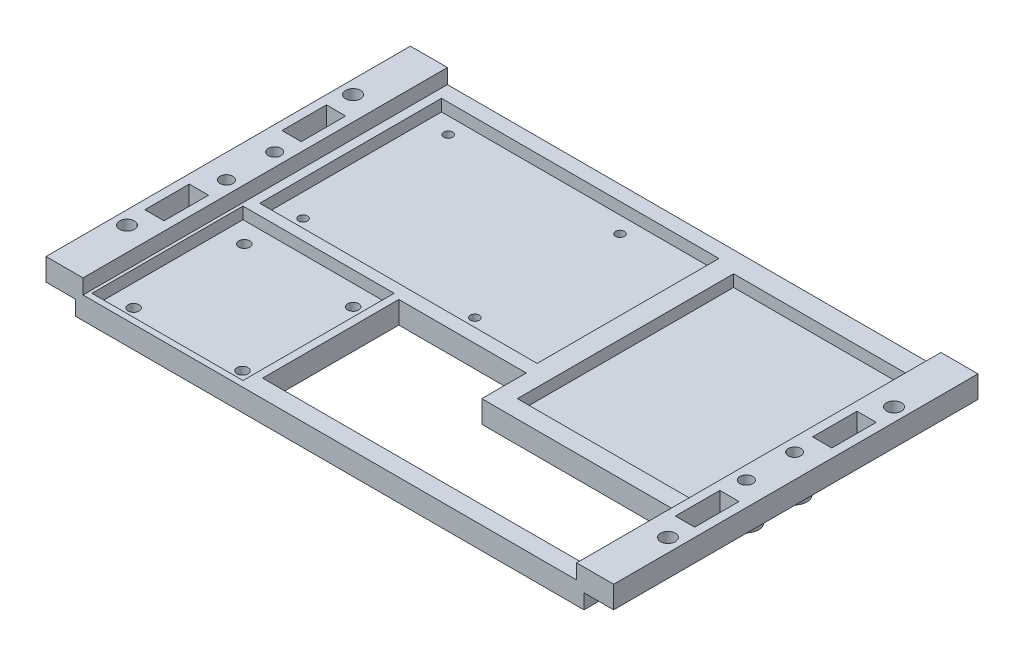
from build123d import *

# Parameters (mm, degrees)
PLATEFRAME_DEPTH          = 150
SKETCH3_R                 = 2.5
HOLESUPPORT_DEPTH         = 244.653052515
SKETCH4_R                 = 4.15
SKETCH4_R_2               = 2.15
CYLINDRICALSUPPORTS_DEPTH = 12.5
SKETCH5_W                 = 43
SKETCH5_H                 = 43
SKETCH5_W_2               = 89.65
SKETCH5_H_2               = 57.35
SKETCH5_W_3               = 58
SKETCH5_H_3               = 73
ITEMLAYOUT_DEPTH          = 4
HOLECUTOUT_DEPTH          = 7.5
SKETCH7_R                 = 1.5
HOLERASPBERRYPI_DEPTH     = 3.5
SKETCH8_R                 = 1.85
HOLEMOTORDRIVER_DEPTH     = 3.5
SKETCH10_W                = 45
SKETCH10_H                = 45
SKETCH10_W_2              = 43
SKETCH10_H_2              = 43
CUTMOTORDRIVER_DEPTH      = 4
SKETCH11_W                = 93.65
SKETCH11_H                = 61.35
SKETCH11_W_2              = 89.65
SKETCH11_H_2              = 57.35
CUTPASPBERRYPI_DEPTH      = 4
SKETCH12_W                = 191.6
SKETCH12_H                = 13
SKETCH12_H_2              = 14
CUTPLATEEDGES_DEPTH       = 12.5
SKETCH13_W                = 6.5
SKETCH13_H                = 15
CUTSHELLHOLES_DEPTH       = 12.5
SKETCH14_W                = 51
SKETCH14_H                = 51
CUTMOTORDRIVER2_DEPTH     = 4
SKETCH15_R                = 2.5
STANDOFFHOLES_DEPTH       = 236.293030071
SKETCH16_W                = 2.5
SKETCH16_H                = 28
CUT_EXTRUDE1_DEPTH        = 5


with BuildPart() as part:
    # Sketch2 → PlateFrame (new body)
    with BuildSketch(Plane.XY):
        Polygon((179.1, 12.5), (191.6, 12.5), (191.6, 5), (184.1, 5), (184.1, 0), (7.5, 0), (7.5, 5), (0, 5), (0, 12.5), (12.5, 12.5), (12.5, 7.5), (179.1, 7.5), align=None)
    extrude(amount=PLATEFRAME_DEPTH)

    # Sketch3 → HoleSupport (cut, through all)
    with BuildSketch(Plane(origin=(0, 12.5, 0), x_dir=(1, 0, 0), z_dir=(0, 1, 0))):
        with Locations((8.05, -66.85)):
            Circle(SKETCH3_R)
        with Locations((8.05, -83.15)):
            Circle(SKETCH3_R)
        with Locations((183.55, -66.85)):
            Circle(SKETCH3_R)
        with Locations((183.55, -83.15)):
            Circle(SKETCH3_R)
    extrude(amount=-HOLESUPPORT_DEPTH, mode=Mode.SUBTRACT)

    # Sketch4 → CylindricalSupports (add)
    # profile 1 of 4: a face of its own
    with BuildSketch(Plane(origin=(0, 12.5, 0), x_dir=(1, 0, 0), z_dir=(0, 1, 0))):
        with Locations((183.55, -66.85)):
            Circle(SKETCH4_R)
        with Locations((183.55, -66.85)):
            Circle(SKETCH4_R_2, mode=Mode.SUBTRACT)
    # profile 2 of 4: a face of its own
    with BuildSketch(Plane(origin=(0, 12.5, 0), x_dir=(1, 0, 0), z_dir=(0, 1, 0))):
        with Locations((183.55, -83.15)):
            Circle(SKETCH4_R)
        with Locations((183.55, -83.15)):
            Circle(SKETCH4_R_2, mode=Mode.SUBTRACT)
    # profile 3 of 4: a face of its own
    with BuildSketch(Plane(origin=(0, 12.5, 0), x_dir=(1, 0, 0), z_dir=(0, 1, 0))):
        with Locations((8.05, -66.85)):
            Circle(SKETCH4_R)
        with Locations((8.05, -66.85)):
            Circle(SKETCH4_R_2, mode=Mode.SUBTRACT)
    # profile 4 of 4: a face of its own
    with BuildSketch(Plane(origin=(0, 12.5, 0), x_dir=(1, 0, 0), z_dir=(0, 1, 0))):
        with Locations((8.05, -83.15)):
            Circle(SKETCH4_R)
        with Locations((8.05, -83.15)):
            Circle(SKETCH4_R_2, mode=Mode.SUBTRACT)
    extrude(amount=-CYLINDRICALSUPPORTS_DEPTH)

    # Sketch5 → ItemLayout (cut)
    with BuildSketch(Plane(origin=(0, 7.5, 0), x_dir=(1, 0, 0), z_dir=(0, 1, 0))):
        with Locations((39, -108.5)):
            Rectangle(SKETCH5_W, SKETCH5_H)
        with Locations((62.325, -48.675)):
            Rectangle(SKETCH5_W_2, SKETCH5_H_2)
        with Locations((145.1, -56.5)):
            Rectangle(SKETCH5_W_3, SKETCH5_H_3)
    extrude(amount=-ITEMLAYOUT_DEPTH, mode=Mode.SUBTRACT)

    # Sketch6 → HoleCutout (cut)
    with BuildSketch(Plane(origin=(0, 7.5, 0), x_dir=(1, 0, 0), z_dir=(0, 1, 0))):
        Polygon((67.1, -84), (110.1, -84), (110.1, -99), (174.1, -99), (174.1, -130), (110.1, -130), (67.1, -130), align=None)
    extrude(amount=-HOLECUTOUT_DEPTH, mode=Mode.SUBTRACT)

    # Sketch7 → HoleRaspberryPi (cut)
    with BuildSketch(Plane(origin=(0, 3.5, 0), x_dir=(1, 0, 0), z_dir=(0, 1, 0))):
        with Locations((23.26, -23.5)):
            Circle(SKETCH7_R)
        with Locations((23.26, -72.5)):
            Circle(SKETCH7_R)
        with Locations((81.26, -72.5)):
            Circle(SKETCH7_R)
        with Locations((81.26, -23.5)):
            Circle(SKETCH7_R)
    extrude(amount=-HOLERASPBERRYPI_DEPTH, mode=Mode.SUBTRACT)

    # Sketch8 → HoleMotorDriver (cut)
    with BuildSketch(Plane(origin=(0, 3.5, 0), x_dir=(1, 0, 0), z_dir=(0, 1, 0))):
        with Locations((57.56, -127.24)):
            Circle(SKETCH8_R)
        with Locations((57.56, -89.86)):
            Circle(SKETCH8_R)
        with Locations((20.81, -89.86)):
            Circle(SKETCH8_R)
        with Locations((20.81, -127.24)):
            Circle(SKETCH8_R)
    extrude(amount=-HOLEMOTORDRIVER_DEPTH, mode=Mode.SUBTRACT)

    # Sketch10 → CutMotorDriver (cut)
    with BuildSketch(Plane(origin=(0, 7.5, 0), x_dir=(1, 0, 0), z_dir=(0, 1, 0))):
        with Locations((39, -108.5)):
            Rectangle(SKETCH10_W, SKETCH10_H)
        with Locations((39, -108.5)):
            Rectangle(SKETCH10_W_2, SKETCH10_H_2, mode=Mode.SUBTRACT)
    extrude(amount=-CUTMOTORDRIVER_DEPTH, mode=Mode.SUBTRACT)

    # Sketch11 → CutPaspberryPi (cut)
    with BuildSketch(Plane(origin=(0, 7.5, 0), x_dir=(1, 0, 0), z_dir=(0, 1, 0))):
        with Locations((62.325, -48.675)):
            Rectangle(SKETCH11_W, SKETCH11_H)
        with Locations((62.325, -48.675)):
            Rectangle(SKETCH11_W_2, SKETCH11_H_2, mode=Mode.SUBTRACT)
    extrude(amount=-CUTPASPBERRYPI_DEPTH, mode=Mode.SUBTRACT)

    # Sketch12 → CutPlateEdges (cut)
    with BuildSketch(Plane(origin=(0, 12.5, 0), x_dir=(1, 0, 0), z_dir=(0, 1, 0))):
        with Locations((95.8, -6.5)):
            Rectangle(SKETCH12_W, SKETCH12_H)
        with Locations((95.8, -143)):
            Rectangle(SKETCH12_W, SKETCH12_H_2)
    extrude(amount=-CUTPLATEEDGES_DEPTH, mode=Mode.SUBTRACT)

    # Sketch13 → CutShellHoles (cut)
    with BuildSketch(Plane(origin=(0, 12.5, 0), x_dir=(1, 0, 0), z_dir=(0, 1, 0))):
        with Locations((6.25, -51.85)):
            Rectangle(SKETCH13_W, SKETCH13_H)
        with Locations((6.25, -98.15)):
            Rectangle(SKETCH13_W, SKETCH13_H)
        with Locations((185.35, -51.85)):
            Rectangle(SKETCH13_W, SKETCH13_H)
        with Locations((185.35, -98.15)):
            Rectangle(SKETCH13_W, SKETCH13_H)
    extrude(amount=-CUTSHELLHOLES_DEPTH, mode=Mode.SUBTRACT)

    # Sketch14 → CutMotorDriver2 (cut)
    with BuildSketch(Plane(origin=(0, 7.5, 0), x_dir=(1, 0, 0), z_dir=(0, 1, 0))):
        with Locations((39, -108.5)):
            Rectangle(SKETCH14_W, SKETCH14_H)
    extrude(amount=-CUTMOTORDRIVER2_DEPTH, mode=Mode.SUBTRACT)

    # Sketch15 → StandoffHoles (cut, through all)
    with BuildSketch(Plane(origin=(0, 12.5, 0), x_dir=(1, 0, 0), z_dir=(0, 1, 0))):
        with Locations((4.5, -36.85)):
            Circle(SKETCH15_R)
        with Locations((4.5, -113.15)):
            Circle(SKETCH15_R)
        with Locations((187.1, -113.15)):
            Circle(SKETCH15_R)
        with Locations((187.1, -36.85)):
            Circle(SKETCH15_R)
    extrude(amount=-STANDOFFHOLES_DEPTH, mode=Mode.SUBTRACT)

    # Sketch16 → Cut-Extrude1 (cut)
    with BuildSketch(Plane.XZ):
        with Locations((8.75, 122)):
            Rectangle(SKETCH16_W, SKETCH16_H)
        with Locations((182.85, 122)):
            Rectangle(SKETCH16_W, SKETCH16_H)
        with Locations((182.85, 27)):
            Rectangle(SKETCH16_W, SKETCH16_H)
        with Locations((8.75, 27)):
            Rectangle(SKETCH16_W, SKETCH16_H)
    extrude(amount=-CUT_EXTRUDE1_DEPTH, mode=Mode.SUBTRACT)


solid = part.part
